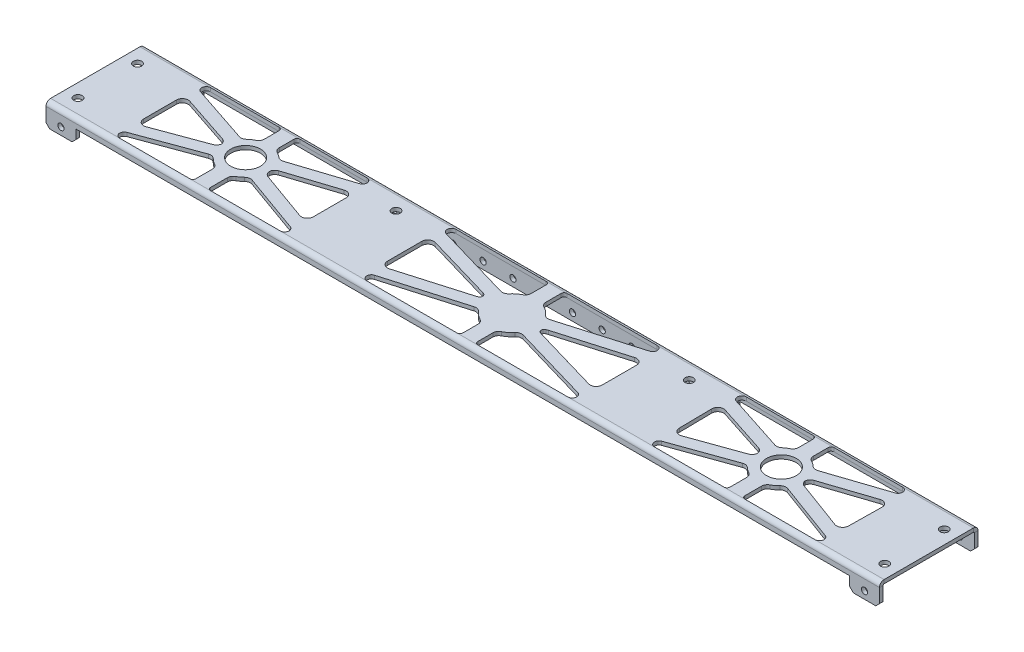
from build123d import *

# Parameters (mm, degrees)
SKETCH1_W                = 711.2
SKETCH1_H                = 76.2
BOSS_EXTRUDE1_DEPTH      = 3.175
EDGE_FLANGE1_DEPTH       = 711.2
EDGE_FLANGE2_DEPTH       = 711.2
SKETCH14_R               = 2.667
UPPER_FLANGE_HP_DEPTH    = 717.328062483
CUT_EXTRUDE7_START       = -3.175
CUT_EXTRUDE7_OUTLINE_W   = 660.4
CUT_EXTRUDE7_OUTLINE_H   = 20.875
CUT_EXTRUDE7_OUTLINE_R   = 2.667
CUT_EXTRUDE7_DEPTH       = 3.937
CHAMFER1_SIZE            = 3.175
SKETCH22_W               = 3.175
SKETCH22_H               = 11.938
BOSS_EXTRUDE2_DEPTH      = 660.4
SKETCH23_W               = 660.4
SKETCH23_H               = 7.9375
CUT_EXTRUDE8_DEPTH       = 127
SKETCH24_R               = 12.7
CUT_EXTRUDE9_DEPTH       = 716.87666144
SKETCH25_R               = 3.571875
CUT_EXTRUDE10_DEPTH      = 254
SKETCH27_W               = 152.4
SKETCH27_H               = 12.100443779
SKETCH27_R               = 2.667
CUT_EXTRUDE12_DEPTH      = 10.16
FILLET1_R                = 5.08
CHAMFER2_SIZE            = 2.54
CUT_EXTRUDE13_DEPTH      = 716.954105561
CUT_EXTRUDE13_DEPTH_BACK = 716.954105561
FILLET10_R               = 3.81
CUT_EXTRUDE14_START      = -10.16
CUT_EXTRUDE14_DEPTH      = 10.16
FILLET11_R               = 5.08
FILLET12_R               = 12.7
FILLET13_R               = 2.54
FILLET14_R               = 5.08
FILLET15_R               = 2.54
SKETCH26_R               = 3.571875
CUT_EXTRUDE15_DEPTH      = 716.95410566


with BuildPart() as part:
    # Sketch1 → Boss-Extrude1 (new body)
    with BuildSketch(Plane(origin=(0, 0, 0), x_dir=(1, 0, 0), z_dir=(0, 1, 0))):
        with Locations((355.6, 38.1)):
            Rectangle(SKETCH1_W, SKETCH1_H)
    extrude(amount=BOSS_EXTRUDE1_DEPTH)

    # Edge-Flange1: sheet metal written as solids
    # Edge-Flange1 section (on a plane across the edge) → Edge-Flange1 (add)
    with BuildSketch(Plane(origin=(711.2, 0, 0.762), x_dir=(0, 0, -1), z_dir=(-1, 0, 0))):
        with BuildLine():
            Line((-3.175, 0.762), (-3.175, 15.875))
            Line((-3.175, 15.875), (0, 15.875))
            Line((0, 15.875), (0, 0.762))
            ThreePointArc((0, 0.762), (0.223184633, 0.223184633), (0.762, 0))
            Line((0.762, 0), (0.762, -3.175))
            ThreePointArc((0.762, -3.175), (-2.021879398, -2.021879398), (-3.175, 0.762))
        make_face()
    extrude(amount=EDGE_FLANGE1_DEPTH)

    # Edge-Flange2: sheet metal written as solids
    # Edge-Flange2 section (on a plane across the edge) → Edge-Flange2 (add)
    with BuildSketch(Plane(origin=(0, 0, -76.962), x_dir=(0, 0, 1), z_dir=(1, 0, 0))):
        with BuildLine():
            Line((-3.175, 0.762), (-3.175, 15.875))
            Line((-3.175, 15.875), (0, 15.875))
            Line((0, 15.875), (0, 0.762))
            ThreePointArc((0, 0.762), (0.223184633, 0.223184633), (0.762, 0))
            Line((0.762, 0), (0.762, -3.175))
            ThreePointArc((0.762, -3.175), (-2.021879398, -2.021879398), (-3.175, 0.762))
        make_face()
    extrude(amount=EDGE_FLANGE2_DEPTH)

    # Sketch14 → upper flange HP (cut, through all)
    with BuildSketch(Plane(origin=(0, 0, -80.137), x_dir=(-1, 0, 0), z_dir=(0, 0, -1))):
        with Locations(Location((-12.7, -9.525, 0), (0, 0, 90))):
            Circle(SKETCH14_R)
        with Locations(Location((-38.1, -9.525, 0), (0, 0, 90))):
            Circle(SKETCH14_R)
        with Locations(Location((-63.5, -9.525, 0), (0, 0, 90))):
            Circle(SKETCH14_R)
        with Locations(Location((-88.9, -9.525, 0), (0, 0, 90))):
            Circle(SKETCH14_R)
        with Locations(Location((-114.3, -9.525, 0), (0, 0, 90))):
            Circle(SKETCH14_R)
        with Locations(Location((-139.7, -9.525, 0), (0, 0, 90))):
            Circle(SKETCH14_R)
        with Locations(Location((-165.1, -9.525, 0), (0, 0, 90))):
            Circle(SKETCH14_R)
        with Locations(Location((-190.5, -9.525, 0), (0, 0, 90))):
            Circle(SKETCH14_R)
        with Locations(Location((-215.9, -9.525, 0), (0, 0, 90))):
            Circle(SKETCH14_R)
        with Locations(Location((-241.3, -9.525, 0), (0, 0, 90))):
            Circle(SKETCH14_R)
        with Locations(Location((-266.7, -9.525, 0), (0, 0, 90))):
            Circle(SKETCH14_R)
        with Locations(Location((-292.1, -9.525, 0), (0, 0, 90))):
            Circle(SKETCH14_R)
        with Locations(Location((-317.5, -9.525, 0), (0, 0, 90))):
            Circle(SKETCH14_R)
        with Locations(Location((-342.9, -9.525, 0), (0, 0, 90))):
            Circle(SKETCH14_R)
        with Locations(Location((-368.3, -9.525, 0), (0, 0, 90))):
            Circle(SKETCH14_R)
        with Locations(Location((-393.7, -9.525, 0), (0, 0, 90))):
            Circle(SKETCH14_R)
        with Locations(Location((-419.1, -9.525, 0), (0, 0, 90))):
            Circle(SKETCH14_R)
        with Locations(Location((-444.5, -9.525, 0), (0, 0, 90))):
            Circle(SKETCH14_R)
        with Locations(Location((-469.9, -9.525, 0), (0, 0, 90))):
            Circle(SKETCH14_R)
        with Locations(Location((-495.3, -9.525, 0), (0, 0, 90))):
            Circle(SKETCH14_R)
        with Locations(Location((-520.7, -9.525, 0), (0, 0, 90))):
            Circle(SKETCH14_R)
        with Locations(Location((-546.1, -9.525, 0), (0, 0, 90))):
            Circle(SKETCH14_R)
        with Locations(Location((-571.5, -9.525, 0), (0, 0, 90))):
            Circle(SKETCH14_R)
        with Locations(Location((-596.9, -9.525, 0), (0, 0, 90))):
            Circle(SKETCH14_R)
        with Locations(Location((-622.3, -9.525, 0), (0, 0, 90))):
            Circle(SKETCH14_R)
        with Locations(Location((-647.7, -9.525, 0), (0, 0, 90))):
            Circle(SKETCH14_R)
        with Locations(Location((-673.1, -9.525, 0), (0, 0, 90))):
            Circle(SKETCH14_R)
        with Locations(Location((-698.5, -9.525, 0), (0, 0, 90))):
            Circle(SKETCH14_R)
        with Locations((-723.9, -9.525)):
            Circle(SKETCH14_R)
        with Locations((-749.3, -9.525)):
            Circle(SKETCH14_R)
        with Locations((-774.7, -9.525)):
            Circle(SKETCH14_R)
        with Locations((-800.1, -9.525)):
            Circle(SKETCH14_R)
    extrude(amount=-UPPER_FLANGE_HP_DEPTH, mode=Mode.SUBTRACT)

    # Cut-Extrude7: read off the stored shape, not the designer's step
    # Cut-Extrude7 outline → Cut-Extrude7 (cut)
    with BuildSketch(Plane(origin=(0, 0, 0.762), x_dir=(-1, 0, 0), z_dir=(0, 0, -1)).offset(CUT_EXTRUDE7_START)):
        with Locations((-355.6, -5.4375)):
            Rectangle(CUT_EXTRUDE7_OUTLINE_W, CUT_EXTRUDE7_OUTLINE_H)
        with Locations((-673.1, -9.525)):
            Circle(CUT_EXTRUDE7_OUTLINE_R, mode=Mode.SUBTRACT)
        with Locations((-647.7, -9.525)):
            Circle(CUT_EXTRUDE7_OUTLINE_R, mode=Mode.SUBTRACT)
        with Locations((-622.3, -9.525)):
            Circle(CUT_EXTRUDE7_OUTLINE_R, mode=Mode.SUBTRACT)
        with Locations((-596.9, -9.525)):
            Circle(CUT_EXTRUDE7_OUTLINE_R, mode=Mode.SUBTRACT)
        with Locations((-571.5, -9.525)):
            Circle(CUT_EXTRUDE7_OUTLINE_R, mode=Mode.SUBTRACT)
        with Locations((-546.1, -9.525)):
            Circle(CUT_EXTRUDE7_OUTLINE_R, mode=Mode.SUBTRACT)
        with Locations((-520.7, -9.525)):
            Circle(CUT_EXTRUDE7_OUTLINE_R, mode=Mode.SUBTRACT)
        with Locations((-495.3, -9.525)):
            Circle(CUT_EXTRUDE7_OUTLINE_R, mode=Mode.SUBTRACT)
        with Locations((-469.9, -9.525)):
            Circle(CUT_EXTRUDE7_OUTLINE_R, mode=Mode.SUBTRACT)
        with Locations((-444.5, -9.525)):
            Circle(CUT_EXTRUDE7_OUTLINE_R, mode=Mode.SUBTRACT)
        with Locations((-419.1, -9.525)):
            Circle(CUT_EXTRUDE7_OUTLINE_R, mode=Mode.SUBTRACT)
        with Locations((-393.7, -9.525)):
            Circle(CUT_EXTRUDE7_OUTLINE_R, mode=Mode.SUBTRACT)
        with Locations((-368.3, -9.525)):
            Circle(CUT_EXTRUDE7_OUTLINE_R, mode=Mode.SUBTRACT)
        with Locations((-342.9, -9.525)):
            Circle(CUT_EXTRUDE7_OUTLINE_R, mode=Mode.SUBTRACT)
        with Locations((-317.5, -9.525)):
            Circle(CUT_EXTRUDE7_OUTLINE_R, mode=Mode.SUBTRACT)
        with Locations((-292.1, -9.525)):
            Circle(CUT_EXTRUDE7_OUTLINE_R, mode=Mode.SUBTRACT)
        with Locations((-266.7, -9.525)):
            Circle(CUT_EXTRUDE7_OUTLINE_R, mode=Mode.SUBTRACT)
        with Locations((-241.3, -9.525)):
            Circle(CUT_EXTRUDE7_OUTLINE_R, mode=Mode.SUBTRACT)
        with Locations((-215.9, -9.525)):
            Circle(CUT_EXTRUDE7_OUTLINE_R, mode=Mode.SUBTRACT)
        with Locations((-190.5, -9.525)):
            Circle(CUT_EXTRUDE7_OUTLINE_R, mode=Mode.SUBTRACT)
        with Locations((-165.1, -9.525)):
            Circle(CUT_EXTRUDE7_OUTLINE_R, mode=Mode.SUBTRACT)
        with Locations((-139.7, -9.525)):
            Circle(CUT_EXTRUDE7_OUTLINE_R, mode=Mode.SUBTRACT)
        with Locations((-114.3, -9.525)):
            Circle(CUT_EXTRUDE7_OUTLINE_R, mode=Mode.SUBTRACT)
        with Locations((-88.9, -9.525)):
            Circle(CUT_EXTRUDE7_OUTLINE_R, mode=Mode.SUBTRACT)
        with Locations((-63.5, -9.525)):
            Circle(CUT_EXTRUDE7_OUTLINE_R, mode=Mode.SUBTRACT)
        with Locations((-38.1, -9.525)):
            Circle(CUT_EXTRUDE7_OUTLINE_R, mode=Mode.SUBTRACT)
    extrude(amount=CUT_EXTRUDE7_DEPTH, mode=Mode.SUBTRACT)

    # Chamfer1
    chamfer1_edges = [part.edges().sort_by_distance(p)[0] for p in [
        (711.2, -15.875, 2.3495),
        (0, -15.875, 2.3495),
        (25.4, -15.875, 2.3495),
        (685.8, -15.875, 2.3495),
        (0, -15.875, -78.5495),
        (711.2, -15.875, -78.5495),
    ]]
    chamfer(chamfer1_edges, length=CHAMFER1_SIZE)

    # Sketch22 → Boss-Extrude2 (add)
    with BuildSketch(Plane.ZY.offset(-685.8)):
        with BuildLine():
            ThreePointArc((0, 0), (0.538815367, -0.223184633), (0.762, -0.762))
            Line((0.762, -0.762), (3.937, -0.762))
            ThreePointArc((3.937, -0.762), (2.783879398, 2.021879398), (0, 3.175))
            Line((0, 3.175), (0, 0))
        make_face()
        with Locations((2.3495, -6.731)):
            Rectangle(SKETCH22_W, SKETCH22_H)
    extrude(amount=BOSS_EXTRUDE2_DEPTH)

    # Sketch23 → Cut-Extrude8 (cut)
    with BuildSketch(Plane(origin=(0, 0, 0.762), x_dir=(-1, 0, 0), z_dir=(0, 0, -1))):
        with Locations((-355.6, -8.73125)):
            Rectangle(SKETCH23_W, SKETCH23_H)
    extrude(amount=-CUT_EXTRUDE8_DEPTH, mode=Mode.SUBTRACT)

    # Sketch24 → Cut-Extrude9 (cut, through all)
    with BuildSketch(Plane(origin=(0, 0, 0), x_dir=(-1, 0, 0), z_dir=(0, -1, 0))):
        with Locations(Location((-584.2, 39.37, 0), (0, 0, 90))):
            Circle(SKETCH24_R)
        with Locations(Location((-127, 39.37, 0), (0, 0, 90))):
            Circle(SKETCH24_R)
    extrude(amount=-CUT_EXTRUDE9_DEPTH, mode=Mode.SUBTRACT)

    # Sketch25 → Cut-Extrude10 (cut)
    with BuildSketch(Plane.XZ):
        with Locations(Location((480.698353713, -64.262, 0), (0, 0, 270))):
            Circle(SKETCH25_R)
        with Locations(Location((230.501646287, -64.262, 0), (0, 0, 270))):
            Circle(SKETCH25_R)
    extrude(amount=-CUT_EXTRUDE10_DEPTH, mode=Mode.SUBTRACT)

    # Sketch27 → Cut-Extrude12 (cut)
    # profile 1 of 2: a face of its own
    with BuildSketch(Plane(origin=(0, 0, -80.137), x_dir=(-1, 0, 0), z_dir=(0, 0, -1))):
        with Locations((-584.2, -9.824778111)):
            Rectangle(SKETCH27_W, SKETCH27_H)
        with Locations((-647.7, -9.525)):
            Circle(SKETCH27_R, mode=Mode.SUBTRACT)
        with Locations((-622.3, -9.525)):
            Circle(SKETCH27_R, mode=Mode.SUBTRACT)
        with Locations((-596.9, -9.525)):
            Circle(SKETCH27_R, mode=Mode.SUBTRACT)
        with Locations((-571.5, -9.525)):
            Circle(SKETCH27_R, mode=Mode.SUBTRACT)
        with Locations((-546.1, -9.525)):
            Circle(SKETCH27_R, mode=Mode.SUBTRACT)
        with Locations((-520.7, -9.525)):
            Circle(SKETCH27_R, mode=Mode.SUBTRACT)
    # profile 2 of 2: a face of its own
    with BuildSketch(Plane(origin=(0, 0, -80.137), x_dir=(-1, 0, 0), z_dir=(0, 0, -1))):
        with Locations((-127, -9.824778111)):
            Rectangle(SKETCH27_W, SKETCH27_H)
    extrude(amount=-CUT_EXTRUDE12_DEPTH, mode=Mode.SUBTRACT)

    # Fillet1
    fillet1_edges = [part.edges().sort_by_distance(p)[0] for p in [
        (660.4, -3.774556221, -78.5495),
        (508, -3.774556221, -78.5495),
        (203.2, -3.774556221, -78.5495),
        (50.8, -3.774556221, -78.5495),
    ]]
    fillet(fillet1_edges, radius=FILLET1_R)

    # Chamfer2
    chamfer2_edges = [part.edges().sort_by_distance(p)[0] for p in [
        (50.8, -15.875, -78.5495),
        (203.2, -15.875, -78.5495),
        (660.4, -15.875, -78.5495),
        (508, -15.875, -78.5495),
    ]]
    chamfer(chamfer2_edges, length=CHAMFER2_SIZE)

    # Sketch29 → Cut-Extrude13 (cut, two sides: drawn at the far end of the back side and taken through both)
    with BuildSketch(Plane(origin=(0, 3.175, 0), x_dir=(1, 0, 0), z_dir=(0, 1, 0)).offset(-CUT_EXTRUDE13_DEPTH_BACK)):
        with BuildLine():
            Line((338.136777745, 27.710665638), (243.201646287, 0))
            Line((243.201646287, 0), (349.25, 0))
            Line((349.25, 0), (349.25, 18.797671125))
            ThreePointArc((349.25, 18.797671125), (342.886709461, 22.248355175), (338.136777745, 27.710665638))
        make_face()
        with BuildLine():
            Line((349.25, 76.2), (243.201646287, 76.2))
            Line((243.201646287, 76.2), (338.136777745, 48.489334362))
            ThreePointArc((338.136777745, 48.489334362), (342.886709461, 53.951644825), (349.25, 57.402328875))
            Line((349.25, 57.402328875), (349.25, 76.2))
        make_face()
        with BuildLine():
            Line((111.84852215, 27.416336047), (37.603233507, 0))
            Line((37.603233507, 0), (121.352439937, 0))
            Line((121.352439937, 0), (121.352439937, 20.067671125))
            ThreePointArc((121.352439937, 20.067671125), (116.008244355, 22.976072787), (111.84852215, 27.416336047))
        make_face()
        with BuildLine():
            Line((134.052439937, 20.067671125), (134.052439937, 0))
            Line((134.052439937, 0), (217.801646287, 0))
            Line((217.801646287, 0), (143.089927398, 26.754841813))
            ThreePointArc((143.089927398, 26.754841813), (139.073858196, 22.73190866), (134.052439937, 20.067671125))
        make_face()
        with BuildLine():
            Line((217.801646287, 76.2), (134.052439937, 76.2))
            Line((134.052439937, 76.2), (134.052439937, 57.697172036))
            ThreePointArc((134.052439937, 57.697172036), (138.904669218, 55.38819571), (142.994665731, 51.902879484))
            Line((142.994665731, 51.902879484), (217.801646287, 76.2))
        make_face()
        with BuildLine():
            Line((121.352439937, 76.2), (36.90079357, 76.2))
            Line((36.90079357, 76.2), (111.824901623, 51.225373476))
            ThreePointArc((111.824901623, 51.225373476), (116.127168492, 55.140679058), (121.352439937, 57.697172036))
            Line((121.352439937, 57.697172036), (121.352439937, 76.2))
        make_face()
        with BuildLine():
            Line((373.063222255, 48.489334362), (467.998353713, 76.2))
            Line((467.998353713, 76.2), (361.95, 76.2))
            Line((361.95, 76.2), (361.95, 57.402328875))
            ThreePointArc((361.95, 57.402328875), (368.313290539, 53.951644825), (373.063222255, 48.489334362))
        make_face()
        with BuildLine():
            Line((493.398353713, 0), (577.147560063, 0))
            Line((577.147560063, 0), (577.147560063, 20.067671125))
            ThreePointArc((577.147560063, 20.067671125), (572.126141804, 22.73190866), (568.110072602, 26.754841813))
            Line((568.110072602, 26.754841813), (493.398353713, 0))
        make_face()
        with BuildLine():
            Line((589.847560063, 20.067671125), (589.847560063, 0))
            Line((589.847560063, 0), (673.596766493, 0))
            Line((673.596766493, 0), (599.35147785, 27.416336047))
            ThreePointArc((599.35147785, 27.416336047), (595.191755645, 22.976072787), (589.847560063, 20.067671125))
        make_face()
        with BuildLine():
            Line((674.29920643, 76.2), (589.847560063, 76.2))
            Line((589.847560063, 76.2), (589.847560063, 57.697172036))
            ThreePointArc((589.847560063, 57.697172036), (595.072831508, 55.140679058), (599.375098377, 51.225373476))
            Line((599.375098377, 51.225373476), (674.29920643, 76.2))
        make_face()
        with BuildLine():
            Line((577.147560063, 57.697172036), (577.147560063, 76.2))
            Line((577.147560063, 76.2), (493.398353713, 76.2))
            Line((493.398353713, 76.2), (568.205334269, 51.902879484))
            ThreePointArc((568.205334269, 51.902879484), (572.295330782, 55.38819571), (577.147560063, 57.697172036))
        make_face()
        with BuildLine():
            Line((467.998353713, 0), (373.063222255, 27.710665638))
            ThreePointArc((373.063222255, 27.710665638), (368.313290539, 22.248355175), (361.95, 18.797671125))
            Line((361.95, 18.797671125), (361.95, 0))
            Line((361.95, 0), (467.998353713, 0))
        make_face()
    extrude(amount=CUT_EXTRUDE13_DEPTH + CUT_EXTRUDE13_DEPTH_BACK, mode=Mode.SUBTRACT)

    # Fillet10
    fillet10_edges = [part.edges().sort_by_distance(p)[0] for p in [
        (243.201646287, 1.5875, -76.2),
        (467.998353713, 1.5875, 0),
        (467.998353713, 1.5875, -76.2),
        (493.398353713, 1.5875, -76.2),
        (217.801646287, 1.5875, -76.2),
        (217.801646287, 1.5875, 0),
        (37.603233507, 1.5875, 0),
        (243.201646287, 1.5875, 0),
        (674.29920643, 1.5875, -76.2),
        (673.596766493, 1.5875, 0),
        (493.398353713, 1.5875, 0),
        (36.90079357, 1.5875, -76.2),
    ]]
    fillet(fillet10_edges, radius=FILLET10_R)

    # Sketch30 → Cut-Extrude14 (cut)
    with BuildSketch(Plane(origin=(0, 3.175, 0), x_dir=(1, 0, 0), z_dir=(0, 1, 0)).offset(CUT_EXTRUDE14_START)):
        with BuildLine():
            Line((335.289965657, 38.736321447), (264.028894581, 59.536753102))
            Line((264.028894581, 59.536753102), (264.028894581, 16.663246898))
            Line((264.028894581, 16.663246898), (335.289965657, 37.463678553))
            ThreePointArc((335.289965657, 37.463678553), (335.28, 38.1), (335.289965657, 38.736321447))
        make_face()
        with BuildLine():
            Line((447.171105419, 16.663246898), (447.171105419, 59.536753102))
            Line((447.171105419, 59.536753102), (375.910034343, 38.736321447))
            ThreePointArc((375.910034343, 38.736321447), (375.92, 38.1), (375.910034343, 37.463678553))
            Line((375.910034343, 37.463678553), (447.171105419, 16.663246898))
        make_face()
        with BuildLine():
            Line((106.873325826, 42.166316632), (54.892532392, 59.493194938))
            Line((54.892532392, 59.493194938), (54.892532392, 17.214937915))
            Line((54.892532392, 17.214937915), (106.89557798, 36.417947282))
            ThreePointArc((106.89557798, 36.417947282), (106.680152245, 39.291341105), (106.873325826, 42.166316632))
        make_face()
        with BuildLine():
            Line((199.615329066, 17.304479681), (199.615329066, 59.610656947))
            Line((199.615329066, 59.610656947), (147.070540484, 42.544240803))
            ThreePointArc((147.070540484, 42.544240803), (147.319968603, 39.334279014), (147.059256315, 36.125214014))
            Line((147.059256315, 36.125214014), (199.615329066, 17.304479681))
        make_face()
        with BuildLine():
            ThreePointArc((564.140743685, 36.125214014), (563.880031397, 39.334279014), (564.129459516, 42.544240803))
            Line((564.129459516, 42.544240803), (511.426027634, 59.662183895))
            Line((511.426027634, 59.662183895), (511.993821071, 17.450999496))
            Line((511.993821071, 17.450999496), (564.140743685, 36.125214014))
        make_face()
        with BuildLine():
            Line((656.959165047, 59.710426755), (604.326674174, 42.166316632))
            ThreePointArc((604.326674174, 42.166316632), (604.519847755, 39.291341105), (604.30442202, 36.417947282))
            Line((604.30442202, 36.417947282), (656.318750312, 17.210771584))
            Line((656.318750312, 17.210771584), (656.959165047, 59.710426755))
        make_face()
    extrude(amount=CUT_EXTRUDE14_DEPTH, mode=Mode.SUBTRACT)

    # Fillet11
    # the kernel refuses this fillet: 5.08 mm, written as the material it adds along each edge
    with BuildSketch(Plane(origin=(143.089927398, 0, -26.754841813), x_dir=(-0.6561478780169986, 0, 0.7546323357594675), z_dir=(0, 1, 0))) as fillet11_piece_1:
        with BuildLine():
            CenterArc((3.477983018, 5.063597702), FILLET11_R, 201.30390862, 64.090609894)
            Line((-1.254882523, 3.217958579), (0, 0))
            ThreePointArc((0, 0), (1.535044023, 0.061727284), (3.070088046, 0))
        make_face()
    extrude(amount=3.175)
    with BuildSketch(Plane(origin=(142.994665731, 3.175, -51.902879484), x_dir=(-0.7177374785406176, 0, -0.696313802748557), z_dir=(0, -1, 0))) as fillet11_piece_2:
        with BuildLine():
            CenterArc((3.065861338, 5.06884117), FILLET11_R, 207.874329836, 58.327323144)
            Line((-1.424732614, 2.693769391), (0, 0))
            ThreePointArc((0, 0), (1.36466808, 0.045250996), (2.72933616, 0))
        make_face()
    extrude(amount=3.175)
    with BuildSketch(Plane(origin=(147.070540484, 0, -42.544240803), x_dir=(0.9510906656690443, 0, -0.308911873642329), z_dir=(0, 1, 0))) as fillet11_piece_3:
        with BuildLine():
            CenterArc((3.949595964, -5.08), FILLET11_R, 90, 71.020023679)
            ThreePointArc((-0.854216106, -3.427792506), (-0.352476718, -1.732494604), (0, 0))
            Line((0, 0), (3.949595964, 0))
        make_face()
    extrude(amount=3.175)
    with BuildSketch(Plane(origin=(147.059256315, 0, -36.125214014), x_dir=(0.07540968904268645, 0, -0.997152635657393), z_dir=(0, 1, 0))) as fillet11_piece_4:
        with BuildLine():
            CenterArc((3.876490388, -5.061707151), FILLET11_R, 94.86381281, 69.758112676)
            Line((-1.021630141, -3.714556349), (0, 0))
            ThreePointArc((0, 0), (1.722884617, -0.073171394), (3.445769234, 0))
        make_face()
    extrude(amount=3.175)
    with BuildSketch(Plane(origin=(134.052439937, 0, -20.067671125), x_dir=(0, 0, 1), z_dir=(0, 1, 0))) as fillet11_piece_5:
        with BuildLine():
            CenterArc((3.29570348, 5.08), FILLET11_R, 208.187499003, 61.812500997)
            ThreePointArc((-1.181841712, 2.680418984), (-0.539505342, 1.362879455), (0, 0))
            Line((0, 0), (3.29570348, 0))
        make_face()
    extrude(amount=3.175)
    with BuildSketch(Plane(origin=(134.052439937, 3.175, -57.697172036), x_dir=(0, 0, -1), z_dir=(0, -1, 0)), Plane(origin=(589.847560063, 3.175, -57.697172036), x_dir=(0, 0, -1), z_dir=(0, -1, 0))) as fillet11_piece_6:
        with BuildLine():
            CenterArc((3.399176047, 5.08), FILLET11_R, 206.429004709, 63.570995291)
            ThreePointArc((-1.149895672, 2.818950134), (-0.52280092, 1.430746644), (0, 0))
            Line((0, 0), (3.399176047, 0))
        make_face()
    extrude(amount=3.175)
    with BuildSketch(Plane(origin=(106.89557798, 0, -36.417947282), x_dir=(-0.9380854257155748, 0, 0.34640400410507466), z_dir=(0, 1, 0))) as fillet11_piece_7:
        with BuildLine():
            CenterArc((3.763764162, -5.08), FILLET11_R, 90, 68.582786777)
            ThreePointArc((-0.965442304, -3.225005069), (-0.415820396, -1.632530044), (0, 0))
            Line((0, 0), (3.763764162, 0))
        make_face()
    extrude(amount=3.175)
    with BuildSketch(Plane(origin=(121.352439937, 3.175, -20.067671125), x_dir=(-0.9150055312576578, 0, -0.4034412940786942), z_dir=(0, -1, 0)), Plane(origin=(577.147560063, 3.175, -20.067671125), x_dir=(-0.915005531257662, 0, -0.4034412940786845), z_dir=(0, -1, 0))) as fillet11_piece_8:
        with BuildLine():
            CenterArc((3.318605222, -5.065068688), FILLET11_R, 94.394011577, 61.812500997)
            Line((-1.329622877, -3.015586914), (0, 0))
            ThreePointArc((0, 0), (1.464700973, -0.056191479), (2.929401946, 0))
        make_face()
    extrude(amount=3.175)
    with BuildSketch(Plane(origin=(111.84852215, 0, -27.416336047), x_dir=(-0.9380854257155743, 0, 0.34640400410507616), z_dir=(0, 1, 0))) as fillet11_piece_9:
        with BuildLine():
            CenterArc((3.634270504, 5.08), FILLET11_R, 203.400654443, 66.599345557)
            ThreePointArc((-1.02789995, 3.062435463), (-0.449151333, 1.552967258), (0, 0))
            Line((0, 0), (3.634270504, 0))
        make_face()
    extrude(amount=3.175)
    with BuildSketch(Plane(origin=(106.873325826, 0, -42.166316632), x_dir=(-0.05315277061743783, 0, 0.9985863923445433), z_dir=(0, 1, 0))) as fillet11_piece_10:
        with BuildLine():
            CenterArc((3.875794294, -5.061713732), FILLET11_R, 94.86293732, 69.749031526)
            Line((-1.022092059, -3.713711774), (0, 0))
            ThreePointArc((0, 0), (1.722575242, -0.07314507), (3.445150483, 0))
        make_face()
    extrude(amount=3.175)
    with BuildSketch(Plane(origin=(121.352439937, 3.175, -57.697172036), x_dir=(-0.9259276337626784, 0, 0.3777009624486642), z_dir=(0, -1, 0)), Plane(origin=(577.147560063, 3.175, -57.697172036), x_dir=(-0.9259276337626796, 0, 0.3777009624486613), z_dir=(0, -1, 0))) as fillet11_piece_11:
        with BuildLine():
            CenterArc((3.419840315, 5.066111923), FILLET11_R, 202.191347495, 63.570995291)
            Line((-1.283872064, 3.147391034), (0, 0))
            ThreePointArc((0, 0), (1.522230265, 0.056318566), (3.044460529, 0))
        make_face()
    extrude(amount=3.175)
    with BuildSketch(Plane(origin=(111.824901623, 0, -51.225373476), x_dir=(-0.9486835873516923, 0, -0.31622689811197885), z_dir=(0, 1, 0))) as fillet11_piece_12:
        with BuildLine():
            CenterArc((3.213274524, -5.08), FILLET11_R, 90, 60.844597031)
            ThreePointArc((-1.223097328, -2.605125298), (-0.565999469, -1.323947839), (0, 0))
            Line((0, 0), (3.213274524, 0))
        make_face()
    extrude(amount=3.175)
    with BuildSketch(Plane(origin=(564.140743685, 0, -36.125214014), x_dir=(-0.0754096890427095, 0, -0.9971526356573912), z_dir=(0, 1, 0))) as fillet11_piece_13:
        with BuildLine():
            CenterArc((3.876490388, 5.061707151), FILLET11_R, 195.378074514, 69.758112676)
            Line((-1.021630141, 3.714556349), (0, 0))
            ThreePointArc((0, 0), (1.722884617, 0.073171394), (3.445769234, 0))
        make_face()
    extrude(amount=3.175)
    with BuildSketch(Plane(origin=(564.129459516, 0, -42.544240803), x_dir=(-0.0697636374635401, 0, 0.9975635492979161), z_dir=(0, 1, 0))) as fillet11_piece_14:
        with BuildLine():
            CenterArc((3.974204277, -5.060771547), FILLET11_R, 94.98672059, 71.020023679)
            Line((-0.95504264, -3.832388529), (0, 0))
            ThreePointArc((0, 0), (1.766313012, -0.076913814), (3.532626024, 0))
        make_face()
    extrude(amount=3.175)
    with BuildSketch(Plane(origin=(568.110072602, 3.175, -26.754841813), x_dir=(-0.9414538527706655, 0, 0.337141873850268), z_dir=(0, -1, 0))) as fillet11_piece_15:
        with BuildLine():
            CenterArc((3.453981408, -5.08), FILLET11_R, 90, 64.090609894)
            ThreePointArc((-1.115408388, -2.860298016), (-0.500194954, -1.452575443), (0, 0))
            Line((0, 0), (3.453981408, 0))
        make_face()
    extrude(amount=3.175)
    with BuildSketch(Plane(origin=(589.847560063, 3.175, -20.067671125), x_dir=(0, 0, 1), z_dir=(0, -1, 0))) as fillet11_piece_16:
        with BuildLine():
            CenterArc((3.29570348, -5.08), FILLET11_R, 90, 61.812500997)
            ThreePointArc((-1.181841712, -2.680418984), (-0.539505342, -1.362879455), (0, 0))
            Line((0, 0), (3.29570348, 0))
        make_face()
    extrude(amount=3.175)
    with BuildSketch(Plane(origin=(599.35147785, 3.175, -27.416336047), x_dir=(-0.6268995127032126, 0, 0.7791001225596583), z_dir=(0, -1, 0))) as fillet11_piece_17:
        with BuildLine():
            CenterArc((3.659524937, -5.061837545), FILLET11_R, 94.846436576, 66.599345557)
            Line((-1.156431758, -3.445371922), (0, 0))
            ThreePointArc((0, 0), (1.61516944, -0.068351342), (3.230338879, 0))
        make_face()
    extrude(amount=3.175)
    with BuildSketch(Plane(origin=(604.30442202, 0, -36.417947282), x_dir=(0.0628227473782158, 0, -0.998024700301477), z_dir=(0, 1, 0))) as fillet11_piece_18:
        with BuildLine():
            CenterArc((3.787214633, -5.062541456), FILLET11_R, 94.751538418, 68.582786777)
            Line((-1.07939731, -3.605665281), (0, 0))
            ThreePointArc((0, 0), (1.683206504, -0.069834177), (3.366413007, 0))
        make_face()
    extrude(amount=3.175)
    with BuildSketch(Plane(origin=(604.326674174, 0, -42.166316632), x_dir=(0.948683587351693, 0, -0.3162268981119772), z_dir=(0, 1, 0))) as fillet11_piece_19:
        with BuildLine():
            CenterArc((3.851795337, -5.08), FILLET11_R, 90, 69.749031526)
            ThreePointArc((-0.914186929, -3.32164479), (-0.386570582, -1.680231784), (0, 0))
            Line((0, 0), (3.851795337, 0))
        make_face()
    extrude(amount=3.175)
    with BuildSketch(Plane(origin=(599.375098377, 0, -51.225373476), x_dir=(-0.6894272732668478, 0, -0.7243549094717582), z_dir=(0, 1, 0))) as fillet11_piece_20:
        with BuildLine():
            CenterArc((3.23280866, -5.067591275), FILLET11_R, 94.005509706, 60.844597031)
            Line((-1.365602576, -2.908653086), (0, 0))
            ThreePointArc((0, 0), (1.43897923, -0.050319534), (2.877958459, 0))
        make_face()
    extrude(amount=3.175)
    with BuildSketch(Plane(origin=(568.205334269, 3.175, -51.902879484), x_dir=(-0.9510906656690442, 0, -0.308911873642329), z_dir=(0, -1, 0))) as fillet11_piece_21:
        with BuildLine():
            CenterArc((3.047335976, 5.08), FILLET11_R, 211.672676856, 58.327323144)
            ThreePointArc((-1.276056947, 2.412665444), (-0.598027716, 1.227489093), (0, 0))
            Line((0, 0), (3.047335976, 0))
        make_face()
    extrude(amount=3.175)
    with BuildSketch(Plane(origin=(349.25, 3.175, -57.402328875), x_dir=(-0.9240342753920577, 0, 0.38230963615984737), z_dir=(0, -1, 0))) as fillet11_piece_22:
        with BuildLine():
            CenterArc((3.401659531, 5.065919916), FILLET11_R, 202.476820407, 63.25631605)
            Line((-1.292434588, 3.123786965), (0, 0))
            ThreePointArc((0, 0), (1.511848681, 0.056320335), (3.023697361, 0))
        make_face()
    extrude(amount=3.175)
    with BuildSketch(Plane(origin=(338.136777745, 3.175, -48.489334362), x_dir=(-0.9599422161052877, 0, -0.2801980402123985), z_dir=(0, -1, 0)), Plane(origin=(338.136777745, 0, -27.710665638), x_dir=(-0.9599422161052885, 0, 0.28019804021239614), z_dir=(0, 1, 0))) as fillet11_piece_23:
        with BuildLine():
            CenterArc((3.604729132, 5.08), FILLET11_R, 203.578178478, 66.421821522)
            ThreePointArc((-1.051167774, 3.048), (-0.465035318, 1.544881465), (0, 0))
            Line((0, 0), (3.604729132, 0))
        make_face()
    extrude(amount=3.175)
    with BuildSketch(Plane(origin=(361.95, 3.175, -57.402328875), x_dir=(0, 0, -1), z_dir=(0, -1, 0))) as fillet11_piece_24:
        with BuildLine():
            CenterArc((3.380596421, 5.08), FILLET11_R, 206.74368395, 63.25631605)
            ThreePointArc((-1.155988638, 2.794), (-0.525952399, 1.418531807), (0, 0))
            Line((0, 0), (3.380596421, 0))
        make_face()
    extrude(amount=3.175)
    with BuildSketch(Plane(origin=(373.063222255, 3.175, -48.489334362), x_dir=(-0.5778557733452425, 0, -0.816138900685154), z_dir=(0, -1, 0))) as fillet11_piece_25:
        with BuildLine():
            CenterArc((3.62718872, 5.063987964), FILLET11_R, 199.027845332, 66.421821522)
            Line((-1.1752413, 3.407767598), (0, 0))
            ThreePointArc((0, 0), (1.612083876, 0.064048144), (3.224167752, 0))
        make_face()
    extrude(amount=3.175)
    with BuildSketch(Plane(origin=(373.063222255, 3.175, -27.710665638), x_dir=(-0.5778557733452513, 0, 0.8161389006851478), z_dir=(0, -1, 0))) as fillet11_piece_26:
        with BuildLine():
            CenterArc((3.62718872, -5.063987964), FILLET11_R, 94.550333146, 66.421821522)
            Line((-1.1752413, -3.407767598), (0, 0))
            ThreePointArc((0, 0), (1.612083876, -0.064048144), (3.224167752, 0))
        make_face()
    extrude(amount=3.175)
    with BuildSketch(Plane(origin=(361.95, 3.175, -18.797671125), x_dir=(0, 0, 1), z_dir=(0, -1, 0))) as fillet11_piece_27:
        with BuildLine():
            CenterArc((3.380596421, -5.08), FILLET11_R, 90, 63.25631605)
            ThreePointArc((-1.155988638, -2.794), (-0.525952399, -1.418531807), (0, 0))
            Line((0, 0), (3.380596421, 0))
        make_face()
    extrude(amount=3.175)
    with BuildSketch(Plane(origin=(349.25, 3.175, -18.797671125), x_dir=(-0.9240342753920577, 0, -0.38230963615984737), z_dir=(0, -1, 0))) as fillet11_piece_28:
        with BuildLine():
            CenterArc((3.401659531, -5.065919916), FILLET11_R, 94.266863543, 63.25631605)
            Line((-1.292434588, -3.123786965), (0, 0))
            ThreePointArc((0, 0), (1.511848681, -0.056320335), (3.023697361, 0))
        make_face()
    extrude(amount=3.175)

    # Fillet12
    # the kernel refuses this fillet: 12.7 mm, written as the material it adds along each edge
    with BuildSketch(Plane(origin=(375.910034343, 0, -37.463678553), x_dir=(0.9599422161052894, 0, 0.2801980402123935), z_dir=(0, 1, 0)), Plane(origin=(335.289965657, 0, -38.736321447), x_dir=(-0.959942216105288, 0, -0.2801980402123979), z_dir=(0, 1, 0))) as fillet12_piece_1:
        with BuildLine():
            CenterArc((8.149550523, 12.7), FILLET12_R, 212.578970393, 57.421029607)
            ThreePointArc((-2.552105601, 5.861538462), (-1.044090741, 3.031765185), (0, 0))
            Line((0, 0), (8.149550523, 0))
        make_face()
    extrude(amount=3.175)
    with BuildSketch(Plane(origin=(375.910034343, 0, -38.736321447), x_dir=(0.9599422161052888, 0, -0.2801980402123948), z_dir=(0, 1, 0))) as fillet12_piece_2:
        with BuildLine():
            CenterArc((8.149550523, -12.7), FILLET12_R, 90, 57.421029607)
            ThreePointArc((-2.552105601, -5.861538462), (-1.044090741, -3.031765185), (0, 0))
            Line((0, 0), (8.149550523, 0))
        make_face()
    extrude(amount=3.175)
    with BuildSketch(Plane(origin=(335.289965657, 0, -37.463678553), x_dir=(0.1263066005618949, 0, -0.991991251299374), z_dir=(0, 1, 0))) as fillet12_piece_3:
        with BuildLine():
            CenterArc((8.390856346, 12.541877989), FILLET12_R, 203.528241289, 57.421029607)
            Line((-3.253309065, 7.472024749), (0, 0))
            ThreePointArc((0, 0), (3.196516703, 0.252995217), (6.393033406, 0))
        make_face()
    extrude(amount=3.175)

    # Fillet13
    fillet13_edges = [part.edges().sort_by_distance(p)[0] for p in [
        (378.612356042, 1.5875, -38.1),
        (332.587643958, 1.5875, -38.1),
    ]]
    fillet(fillet13_edges, radius=FILLET13_R)

    # Fillet14
    fillet14_edges = [part.edges().sort_by_distance(p)[0] for p in [
        (54.892532392, 1.5875, -17.214937915),
        (54.892532392, 1.5875, -59.493194938),
        (656.318750312, 1.5875, -17.210771584),
        (656.959165047, 1.5875, -59.710426755),
        (511.993821071, 1.5875, -17.450999496),
        (511.426027634, 1.5875, -59.662183895),
        (447.171105419, 1.5875, -59.536753102),
        (447.171105419, 1.5875, -16.663246898),
        (264.028894581, 1.5875, -16.663246898),
        (264.028894581, 1.5875, -59.536753102),
        (199.615329066, 1.5875, -59.610656947),
        (199.615329066, 1.5875, -17.304479681),
    ]]
    fillet(fillet14_edges, radius=FILLET14_R)

    # Fillet15
    fillet15_edges = [part.edges().sort_by_distance(p)[0] for p in [
        (349.25, 1.5875, -76.2),
        (361.95, 1.5875, 0),
        (361.95, 1.5875, -76.2),
        (577.147560063, 1.5875, -76.2),
        (134.052439937, 1.5875, -76.2),
        (134.052439937, 1.5875, 0),
        (121.352439937, 1.5875, 0),
        (349.25, 1.5875, 0),
        (589.847560063, 1.5875, -76.2),
        (589.847560063, 1.5875, 0),
        (577.147560063, 1.5875, 0),
        (121.352439937, 1.5875, -76.2),
    ]]
    fillet(fillet15_edges, radius=FILLET15_R)

    # Sketch26 → Cut-Extrude15 (cut, through all)
    with BuildSketch(Plane(origin=(0, 3.175, 0), x_dir=(1, 0, 0), z_dir=(0, 1, 0))):
        with Locations(Location((699.77, 62.738, 0), (0, 0, 270))):
            Circle(SKETCH26_R)
        with Locations(Location((699.77, 11.938, 0), (0, 0, 270))):
            Circle(SKETCH26_R)
        with Locations(Location((11.43, 11.938, 0), (0, 0, 90))):
            Circle(SKETCH26_R)
        with Locations(Location((11.43, 62.738, 0), (0, 0, 90))):
            Circle(SKETCH26_R)
    extrude(amount=-CUT_EXTRUDE15_DEPTH, mode=Mode.SUBTRACT)


solid = part.part
